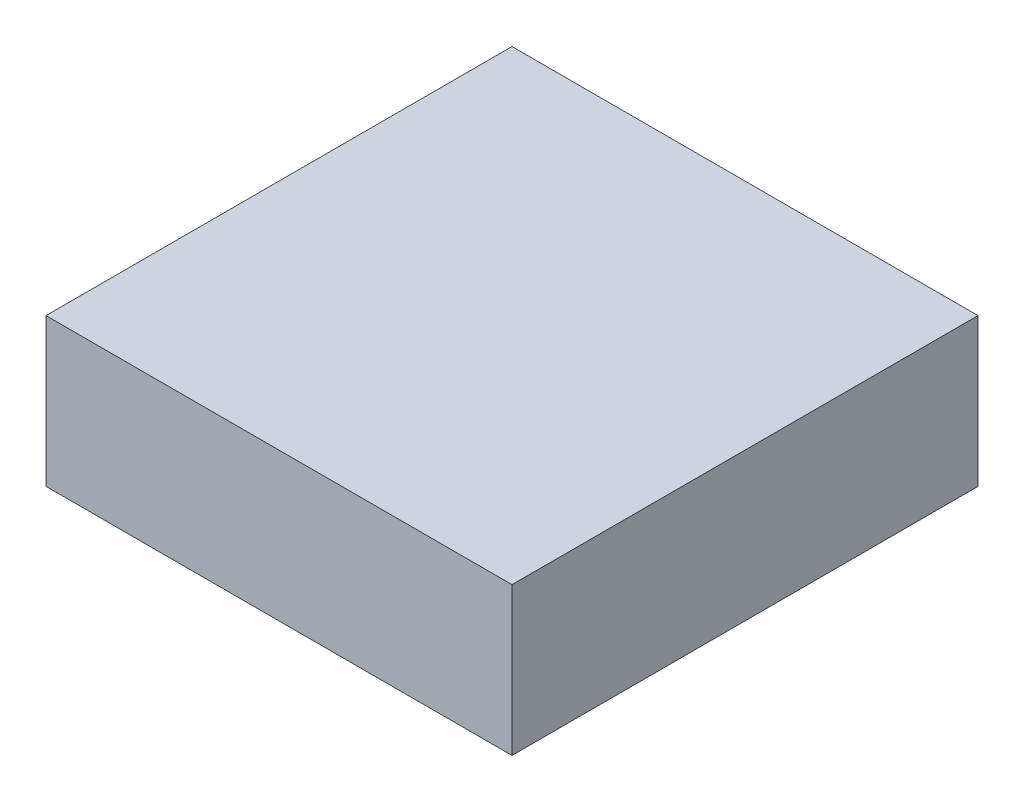
from build123d import *

# Parameters (mm, degrees)
SKETCH_1_W                 = 126
SKETCH_1_H                 = 126
EXTRUDE_2_DEPTH            = 40
SKETCH_7_W                 = 120
SKETCH_7_H                 = 120
CUT_EXTRUDE_1_DEPTH        = 35
EXTRUDE_3_OUTLINE_W        = 66
EXTRUDE_3_OUTLINE_H        = 66
EXTRUDE_3_OUTLINE_W_2      = 60
EXTRUDE_3_OUTLINE_H_2      = 60
EXTRUDE_3_DEPTH            = 35
EXTRUDE_3_2_OUTLINE_W      = 60
EXTRUDE_3_2_OUTLINE_H      = 60
EXTRUDE_3_2_DEPTH          = 3
EXTRUDE_START              = 32
EXTRUDE_3_3_OUTLINE_W      = 60
EXTRUDE_3_3_OUTLINE_H      = 60
EXTRUDE_3_3_DEPTH          = 3
SKETCH_9_W                 = 56
SKETCH_9_H                 = 20
CUT_EXTRUDE_2_DEPTH        = 3
SKETCH_10_W                = 100
SKETCH_10_H                = 100
SKETCH_10_W_2              = 98
SKETCH_10_H_2              = 98
EXTRUDE_3_4_DEPTH          = 10
SKETCH_11_R                = 3
CUT_EXTRUDE_3_DEPTH        = 3
SCALE_1_SCALE              = 1.666667
SKETCH_13_W                = 201.00004
SKETCH_13_H                = 201.00004
SKETCH_13_W_2              = 200.00004
SKETCH_13_H_2              = 200.00004
CUT_EXTRUDE_4_DEPTH        = 60
SKETCH_14_W                = 93.333352
SKETCH_14_H                = 15.000005
CUT_EXTRUDE_5_DEPTH        = 60
PATTERN_START              = -17.686023251
PATTERN_LINEAR_2_OUTLINE_R = 5.000001
PATTERN_LINEAR_2_DEPTH     = 5.000001
PATTERN_LINEAR_3_OUTLINE_R = 5.000001
PATTERN_LINEAR_3_DEPTH     = 5.000001
SKETCH_15_R                = 7.5
CUT_EXTRUDE_6_DEPTH        = 30


# Read off the part's stored shape, not the designer's step: 拉伸-薄壁3, 阵列(线性)2, 阵列(线性)3
with BuildPart() as part:
    # 草图1 → 凸台-拉伸2 (new body)
    with BuildSketch(Plane(origin=(0, 0, 0), x_dir=(1, 0, 0), z_dir=(0, 1, 0))):
        with Locations((63, -63)):
            Rectangle(SKETCH_1_W, SKETCH_1_H)
    extrude(amount=EXTRUDE_2_DEPTH)

    # 草图7 → 切除-拉伸1 (cut)
    with BuildSketch(Plane(origin=(0, 0, 0), x_dir=(1, 0, 0), z_dir=(0, 1, 0))):
        with Locations((63, -63)):
            Rectangle(SKETCH_7_W, SKETCH_7_H)
    extrude(amount=CUT_EXTRUDE_1_DEPTH, mode=Mode.SUBTRACT)

    # Extrude 3 outline → Extrude 3 (add)
    with BuildSketch(Plane.XZ.offset(-35)):
        with Locations((63, 63)):
            Rectangle(EXTRUDE_3_OUTLINE_W, EXTRUDE_3_OUTLINE_H)
        with Locations((63, 63)):
            Rectangle(EXTRUDE_3_OUTLINE_W_2, EXTRUDE_3_OUTLINE_H_2, mode=Mode.SUBTRACT)
    extrude(amount=EXTRUDE_3_DEPTH)

    # Extrude 3 2 outline → Extrude 3 2 (add)
    with BuildSketch(Plane.XZ.offset(-35)):
        with Locations((63, 63)):
            Rectangle(EXTRUDE_3_2_OUTLINE_W, EXTRUDE_3_2_OUTLINE_H)
    extrude(amount=EXTRUDE_3_2_DEPTH)

    # Extrude 3 3 outline → Extrude 3 3 (add)
    with BuildSketch(Plane.XZ.offset(-35).offset(EXTRUDE_START)):
        with Locations((63, 63)):
            Rectangle(EXTRUDE_3_3_OUTLINE_W, EXTRUDE_3_3_OUTLINE_H)
    extrude(amount=EXTRUDE_3_3_DEPTH)

    # 草图9 → 切除-拉伸2 (cut)
    with BuildSketch(Plane.XY.offset(96)):
        with Locations((64, 25)):
            Rectangle(SKETCH_9_W, SKETCH_9_H)
    extrude(amount=-CUT_EXTRUDE_2_DEPTH, mode=Mode.SUBTRACT)

    # 草图10 → Extrude 3 4 (add)
    with BuildSketch(Plane.XZ.offset(-35)):
        with Locations((63, 63)):
            Rectangle(SKETCH_10_W, SKETCH_10_H)
        with Locations((63, 63)):
            Rectangle(SKETCH_10_W_2, SKETCH_10_H_2, mode=Mode.SUBTRACT)
    extrude(amount=EXTRUDE_3_4_DEPTH)

    # 草图11 → 切除-拉伸3 (cut)
    with BuildSketch(Plane.XZ):
        with Locations(Location((50, 76, 0), (0, 0, 270))):
            Circle(SKETCH_11_R)
        with Locations(Location((76, 76, 0), (0, 0, 90))):
            Circle(SKETCH_11_R)
        with Locations(Location((76, 50, 0), (0, 0, 270))):
            Circle(SKETCH_11_R)
        with Locations(Location((50, 50, 0), (0, 0, 90))):
            Circle(SKETCH_11_R)
        with Locations(Location((63, 63, 0), (0, 0, 270))):
            Circle(SKETCH_11_R)
    extrude(amount=-CUT_EXTRUDE_3_DEPTH, mode=Mode.SUBTRACT)


with BuildPart() as part_1:
    # 缩放比例1: scaled about (62.981257937, 26.529021612, 62.409625003)
    add(part.part.scale(SCALE_1_SCALE).moved(Location((-41.987526285, -17.686023251, -41.606437472))))

    # 草图13 → 切除-拉伸4 (cut)
    with BuildSketch(Plane.XZ.offset(17.686023251)):
        with Locations((63.012494715, 63.393583528)):
            Rectangle(SKETCH_13_W, SKETCH_13_H)
        with Locations((63.012494715, 63.393583528)):
            Rectangle(SKETCH_13_W_2, SKETCH_13_H_2, mode=Mode.SUBTRACT)
    extrude(amount=-CUT_EXTRUDE_4_DEPTH, mode=Mode.SUBTRACT)

    # 草图14 → 切除-拉伸5 (cut)
    with BuildSketch(Plane.XY.offset(118.393594528)):
        with Locations((64.679161715, -0.186020751)):
            Rectangle(SKETCH_14_W, SKETCH_14_H)
    extrude(amount=-CUT_EXTRUDE_5_DEPTH, mode=Mode.SUBTRACT)

    # 阵列(线性)2 outline → 阵列(线性)2 (cut)
    with BuildSketch(Plane(origin=(0, 0, 0), x_dir=(1, 0, 0), z_dir=(0, 1, 0)).offset(PATTERN_START)):
        with Locations((63.012494715, -43.393583528)):
            Circle(PATTERN_LINEAR_2_OUTLINE_R)
        with Locations((41.345823715, -65.060254528)):
            Circle(PATTERN_LINEAR_2_OUTLINE_R)
        with Locations((84.679165715, -65.060254528)):
            Circle(PATTERN_LINEAR_2_OUTLINE_R)
        with Locations((84.679165715, -21.726912528)):
            Circle(PATTERN_LINEAR_2_OUTLINE_R)
        with Locations((41.345823715, -21.726912528)):
            Circle(PATTERN_LINEAR_2_OUTLINE_R)
    extrude(amount=PATTERN_LINEAR_2_DEPTH, mode=Mode.SUBTRACT)

    # 阵列(线性)3 outline → 阵列(线性)3 (cut)
    with BuildSketch(Plane(origin=(0, 0, 0), x_dir=(1, 0, 0), z_dir=(0, 1, 0)).offset(PATTERN_START)):
        with Locations((63.012494715, -86.293583528)):
            Circle(PATTERN_LINEAR_3_OUTLINE_R)
        with Locations((63.012494715, -106.293583528)):
            Circle(PATTERN_LINEAR_3_OUTLINE_R)
        with Locations((41.345823715, -107.960254528)):
            Circle(PATTERN_LINEAR_3_OUTLINE_R)
        with Locations((84.679165715, -107.960254528)):
            Circle(PATTERN_LINEAR_3_OUTLINE_R)
        with BuildLine():
            ThreePointArc((89.674469878, -64.843583528), (84.679165715, -59.626911528), (79.683861552, -64.843583528))
            ThreePointArc((79.683861552, -64.843583528), (84.679165715, -60.060253528), (89.674469878, -64.843583528))
        make_face()
        with BuildLine():
            ThreePointArc((89.674469878, -84.843583528), (84.679165715, -79.626911528), (79.683861552, -84.843583528))
            ThreePointArc((79.683861552, -84.843583528), (84.679165715, -80.060253528), (89.674469878, -84.843583528))
        make_face()
        with BuildLine():
            ThreePointArc((46.341127878, -64.843583528), (41.345823715, -59.626911528), (36.350519552, -64.843583528))
            ThreePointArc((36.350519552, -64.843583528), (41.345823715, -60.060253528), (46.341127878, -64.843583528))
        make_face()
        with BuildLine():
            ThreePointArc((46.341127878, -84.843583528), (41.345823715, -79.626911528), (36.350519552, -84.843583528))
            ThreePointArc((36.350519552, -84.843583528), (41.345823715, -80.060253528), (46.341127878, -84.843583528))
        make_face()
    extrude(amount=PATTERN_LINEAR_3_DEPTH, mode=Mode.SUBTRACT)

    # 草图15 → 切除-拉伸6 (cut)
    with BuildSketch(Plane.XZ.offset(17.686023251)):
        with Locations(Location((103.012505715, 68.393594528, 0), (0, 0, 270))):
            Circle(SKETCH_15_R)
        with Locations(Location((23.012483715, 68.393594528, 0), (0, 0, 270))):
            Circle(SKETCH_15_R)
    extrude(amount=-CUT_EXTRUDE_6_DEPTH, mode=Mode.SUBTRACT)


solid = part_1.part
